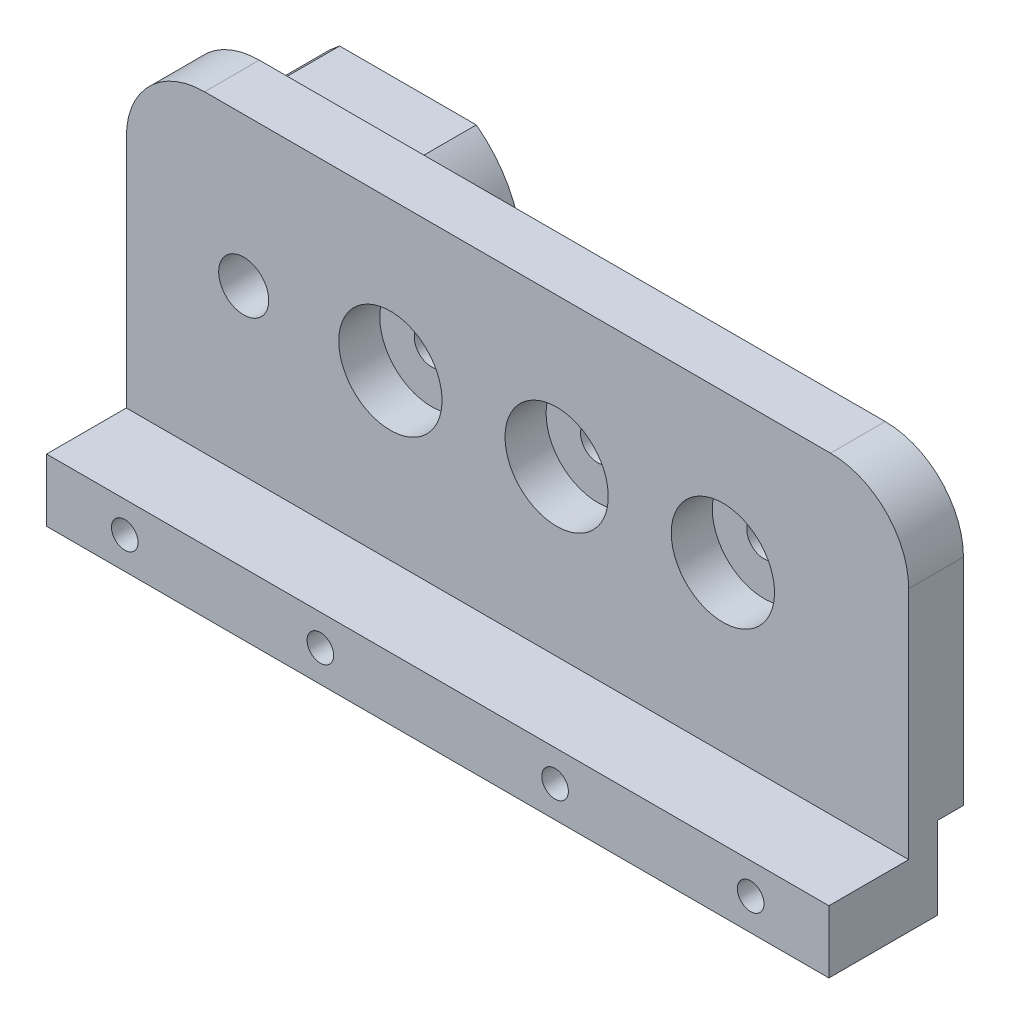
from build123d import *

# Parameters (mm, degrees)
SKETCH1_W           = 100
SKETCH1_H           = 48
BOSS_EXTRUDE1_DEPTH = 7
CUT_EXTRUDE1_REACH  = 113.144
SKETCH2_R           = 3.2
SKETCH2_R_2         = 2.2
SKETCH3_W           = 100
SKETCH3_H           = 8
BOSS_EXTRUDE2_DEPTH = 10.2
SKETCH4_R           = 6.6
CUT_EXTRUDE2_DEPTH  = 5.25
SKETCH5_R           = 2.6
CUT_EXTRUDE3_DEPTH  = 0.1
SKETCH7_R           = 1.7
CUT_EXTRUDE4_DEPTH  = 113.233729333
CUT_EXTRUDE5_REACH  = 114.249
SKETCH8_R           = 1.7
CUT_EXTRUDE6_REACH  = 116.257
SKETCH9_W           = 3.3
SKETCH9_H           = 10.5
BOSS_EXTRUDE3_DEPTH = 14
SHELL1_T            = 2.5
FILLET3_R           = 10
CUT_EXTRUDE7_START  = -3
SKETCH11_R          = 1.7
CUT_EXTRUDE7_DEPTH  = 3.2


with BuildPart() as part:
    # Sketch1 → Boss-Extrude1 (new body)
    with BuildSketch(Plane.XY):
        with Locations((50, 24)):
            Rectangle(SKETCH1_W, SKETCH1_H)
    extrude(amount=BOSS_EXTRUDE1_DEPTH)

    # Sketch2 → Cut-Extrude1 (cut, up to next)
    with BuildSketch(Plane.XY.offset(7), mode=Mode.PRIVATE) as cut_extrude1_sk1:
        with Locations((15, 29)):
            Circle(SKETCH2_R)
    cut_extrude1_tool1 = extrude(cut_extrude1_sk1.sketch, amount=-CUT_EXTRUDE1_REACH, mode=Mode.PRIVATE) & part.part
    # Sketch2 → Cut-Extrude1 (cut, up to next)
    with BuildSketch(Plane.XY.offset(7), mode=Mode.PRIVATE) as cut_extrude1_sk2:
        with Locations((33.75, 29)):
            Circle(SKETCH2_R_2)
    cut_extrude1_tool2 = extrude(cut_extrude1_sk2.sketch, amount=-CUT_EXTRUDE1_REACH, mode=Mode.PRIVATE) & part.part
    # Sketch2 → Cut-Extrude1 (cut, up to next)
    with BuildSketch(Plane.XY.offset(7), mode=Mode.PRIVATE) as cut_extrude1_sk3:
        with Locations((55, 29)):
            Circle(SKETCH2_R_2)
    cut_extrude1_tool3 = extrude(cut_extrude1_sk3.sketch, amount=-CUT_EXTRUDE1_REACH, mode=Mode.PRIVATE) & part.part
    # Sketch2 → Cut-Extrude1 (cut, up to next)
    with BuildSketch(Plane.XY.offset(7), mode=Mode.PRIVATE) as cut_extrude1_sk4:
        with Locations((76.25, 29)):
            Circle(SKETCH2_R_2)
    cut_extrude1_tool4 = extrude(cut_extrude1_sk4.sketch, amount=-CUT_EXTRUDE1_REACH, mode=Mode.PRIVATE) & part.part
    add(cut_extrude1_tool1.solids().sort_by_distance((15, 29, 7))[0], mode=Mode.SUBTRACT)
    add(cut_extrude1_tool2.solids().sort_by_distance((33.75, 29, 7))[0], mode=Mode.SUBTRACT)
    add(cut_extrude1_tool3.solids().sort_by_distance((55, 29, 7))[0], mode=Mode.SUBTRACT)
    add(cut_extrude1_tool4.solids().sort_by_distance((76.25, 29, 7))[0], mode=Mode.SUBTRACT)

    # Sketch3 → Boss-Extrude2 (add)
    with BuildSketch(Plane(origin=(0, 0, 0), x_dir=(-1, 0, 0), z_dir=(0, 0, -1))):
        with Locations((-50, 4)):
            Rectangle(SKETCH3_W, SKETCH3_H)
    extrude(amount=BOSS_EXTRUDE2_DEPTH)

    # Sketch4 → Cut-Extrude2 (cut)
    with BuildSketch(Plane(origin=(0, 0, 0), x_dir=(-1, 0, 0), z_dir=(0, 0, -1))):
        with Locations((-76.25, 29)):
            Circle(SKETCH4_R)
        with Locations((-55, 29)):
            Circle(SKETCH4_R)
        with Locations((-33.75, 29)):
            Circle(SKETCH4_R)
    extrude(amount=-CUT_EXTRUDE2_DEPTH, mode=Mode.SUBTRACT)

    # Sketch5 → Cut-Extrude3 (cut)
    with BuildSketch(Plane.XY.offset(7)):
        with Locations((35.000022648, 4.052132501)):
            Circle(SKETCH5_R)
        with Locations((64.999977352, 4)):
            Circle(SKETCH5_R)
    extrude(amount=-CUT_EXTRUDE3_DEPTH, mode=Mode.SUBTRACT)

    # Sketch7 → Cut-Extrude4 (cut, through all)
    with BuildSketch(Plane.XY.offset(6.9)):
        with Locations((35.000022648, 4.052132501)):
            Circle(SKETCH7_R)
        with Locations((64.999977352, 4)):
            Circle(SKETCH7_R)
    extrude(amount=-CUT_EXTRUDE4_DEPTH, mode=Mode.SUBTRACT)

    # Sketch8 → Cut-Extrude5 (cut, up to next)
    with BuildSketch(Plane.XY.offset(7), mode=Mode.PRIVATE) as cut_extrude5_sk1:
        with Locations((10, 4.052132501)):
            Circle(SKETCH8_R)
    cut_extrude5_tool1 = extrude(cut_extrude5_sk1.sketch, amount=-CUT_EXTRUDE5_REACH, mode=Mode.PRIVATE) & part.part
    # Sketch8 → Cut-Extrude5 (cut, up to next)
    with BuildSketch(Plane.XY.offset(7), mode=Mode.PRIVATE) as cut_extrude5_sk2:
        with Locations((90, 4.052132501)):
            Circle(SKETCH8_R)
    cut_extrude5_tool2 = extrude(cut_extrude5_sk2.sketch, amount=-CUT_EXTRUDE5_REACH, mode=Mode.PRIVATE) & part.part
    add(cut_extrude5_tool1.solids().sort_by_distance((10, 4.052133, 7))[0], mode=Mode.SUBTRACT)
    add(cut_extrude5_tool2.solids().sort_by_distance((90, 4.052133, 7))[0], mode=Mode.SUBTRACT)


with BuildPart() as body_2:
    # Mirror1: mirrored copy
    add(part.part.mirror(Plane.XY.offset(-10.2)))

    # Sketch9 → Cut-Extrude6 (cut, up to next)
    with BuildSketch(Plane(origin=(100, 0, 0), x_dir=(0, 0, -1), z_dir=(1, 0, 0)), mode=Mode.PRIVATE) as cut_extrude6_sk1:
        with Locations((25.75, 5.25)):
            Rectangle(SKETCH9_W, SKETCH9_H)
    cut_extrude6_tool1 = extrude(cut_extrude6_sk1.sketch, amount=-CUT_EXTRUDE6_REACH, mode=Mode.PRIVATE) & body_2.part
    add(cut_extrude6_tool1.solids().sort_by_distance((100, 5.25, -25.75))[0], mode=Mode.SUBTRACT)


with BuildPart() as body_2_2:
    # Sketch10 → Boss-Extrude3 (new body)
    with BuildSketch(Plane(origin=(0, 0, -27.4), x_dir=(-1, 0, 0), z_dir=(0, 0, -1))):
        with BuildLine():
            Line((-7.140610711, 38.2), (-22.859389289, 38.2))
            ThreePointArc((-22.859389289, 38.2), (-27.1, 29), (-22.859389289, 19.8))
            Line((-22.859389289, 19.8), (-7.140610711, 19.8))
            ThreePointArc((-7.140610711, 19.8), (-2.9, 29), (-7.140610711, 38.2))
        make_face()
    extrude(amount=BOSS_EXTRUDE3_DEPTH)

    # Shell1
    shell1_openings = [body_2_2.faces().sort_by_distance(p)[0] for p in [
        (15, 29, -27.4),
        (15, 29, -41.4),
    ]]
    offset(amount=SHELL1_T, openings=shell1_openings, kind=Kind.INTERSECTION)


with BuildPart() as body_2_1:
    add(body_2.part)

    # Combine1: union body 2 2
    add(body_2_2.part)

    # Fillet3
    fillet3_edges = [body_2_1.edges().sort_by_distance(p)[0] for p in [
        (0, 48, -23.9),
        (100, 48, -23.9),
    ]]
    fillet(fillet3_edges, radius=FILLET3_R)

    # Sketch11 → Cut-Extrude7 (cut)
    with BuildSketch(Plane(origin=(0, 0, -24.1), x_dir=(-1, 0, 0), z_dir=(0, 0, -1)).offset(CUT_EXTRUDE7_START)):
        Polygon((-60.958525467, 0), (-60.958525467, 4), (-62.97925141, 7.5), (-67.020703294, 7.5), (-69.041429236, 4), (-69.041429236, 0), align=None)
        with Locations((-64.999977352, 4)):
            Circle(SKETCH11_R, mode=Mode.SUBTRACT)
    extrude(amount=-CUT_EXTRUDE7_DEPTH, mode=Mode.SUBTRACT)


solid = body_2_1.part
